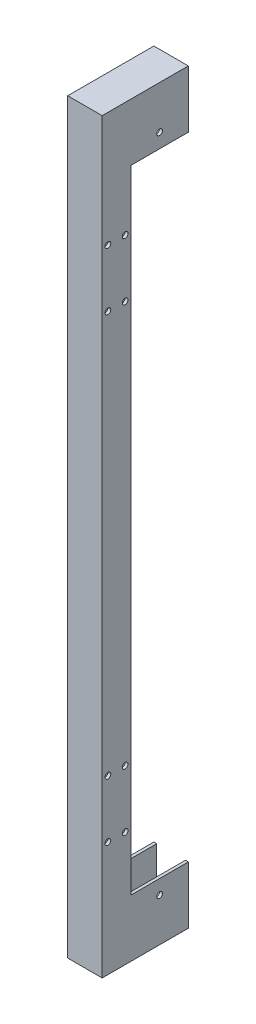
from build123d import *

# Parameters (mm, degrees)
BOSS_EXTRUDE1_DEPTH = 30
SHELL1_START        = -645
SHELL1_OUTLINE_W    = 50
SHELL1_OUTLINE_H    = 40
SHELL1_DEPTH        = 1290
SHELL1_2_OUTLINE_W  = 50
SHELL1_2_OUTLINE_H  = 105
SHELL1_2_DEPTH      = 95
SHELL1_START_2      = 550
SHELL1_3_OUTLINE_W  = 50
SHELL1_3_OUTLINE_H  = 105
SHELL1_3_DEPTH      = 95
SKETCH2_R           = 5
CUT_EXTRUDE1_DEPTH  = 665.623953827
CUT_EXTRUDE2_REACH  = 666.624
SKETCH3_R           = 5


# Read off the part's stored shape, not the designer's step: Shell1
with BuildPart() as part:
    # Sketch1 → Boss-Extrude1 (new, symmetric)
    with BuildSketch(Plane.YZ):
        Polygon((-550, -25), (550, -25), (550, -125), (650, -125), (650, 25), (550, 25), (-550, 25), (-650, 25), (-650, -125), (-550, -125), align=None)
    extrude(amount=BOSS_EXTRUDE1_DEPTH, both=True)

    # Shell1 outline → Shell1 (cut)
    with BuildSketch(Plane(origin=(0, 0, 0), x_dir=(1, 0, 0), z_dir=(0, 1, 0)).offset(SHELL1_START)):
        Rectangle(SHELL1_OUTLINE_W, SHELL1_OUTLINE_H)
    extrude(amount=SHELL1_DEPTH, mode=Mode.SUBTRACT)

    # Shell1 2 outline → Shell1 2 (cut)
    with BuildSketch(Plane(origin=(0, 0, 0), x_dir=(1, 0, 0), z_dir=(0, 1, 0)).offset(SHELL1_START)):
        with Locations((0, 72.5)):
            Rectangle(SHELL1_2_OUTLINE_W, SHELL1_2_OUTLINE_H)
    extrude(amount=SHELL1_2_DEPTH, mode=Mode.SUBTRACT)

    # Shell1 3 outline → Shell1 3 (cut)
    with BuildSketch(Plane(origin=(0, 0, 0), x_dir=(1, 0, 0), z_dir=(0, 1, 0)).offset(SHELL1_START_2)):
        with Locations((0, 72.5)):
            Rectangle(SHELL1_3_OUTLINE_W, SHELL1_3_OUTLINE_H)
    extrude(amount=SHELL1_3_DEPTH, mode=Mode.SUBTRACT)

    # Sketch2 → Cut-Extrude1 (cut, through all)
    with BuildSketch(Plane.YZ.offset(30)):
        with Locations(Location((-575, -75, 0), (0, 0, 270))):
            Circle(SKETCH2_R)
        with Locations(Location((575, -75, 0), (0, 0, 270))):
            Circle(SKETCH2_R)
    extrude(amount=-CUT_EXTRUDE1_DEPTH, mode=Mode.SUBTRACT)

    # Sketch3 → Cut-Extrude2 (cut, up to next)
    with BuildSketch(Plane.YZ.offset(30), mode=Mode.PRIVATE) as cut_extrude2_sk1:
        with Locations(Location((-350, 15, 0), (0, 0, 270))):
            Circle(SKETCH3_R)
    cut_extrude2_tool1 = extrude(cut_extrude2_sk1.sketch, amount=-CUT_EXTRUDE2_REACH, mode=Mode.PRIVATE) & part.part
    # Sketch3 → Cut-Extrude2 (cut, up to next)
    with BuildSketch(Plane.YZ.offset(30), mode=Mode.PRIVATE) as cut_extrude2_sk2:
        with Locations(Location((-350, -15, 0), (0, 0, 270))):
            Circle(SKETCH3_R)
    cut_extrude2_tool2 = extrude(cut_extrude2_sk2.sketch, amount=-CUT_EXTRUDE2_REACH, mode=Mode.PRIVATE) & part.part
    # Sketch3 → Cut-Extrude2 (cut, up to next)
    with BuildSketch(Plane.YZ.offset(30), mode=Mode.PRIVATE) as cut_extrude2_sk3:
        with Locations(Location((-450, 15, 0), (0, 0, 90))):
            Circle(SKETCH3_R)
    cut_extrude2_tool3 = extrude(cut_extrude2_sk3.sketch, amount=-CUT_EXTRUDE2_REACH, mode=Mode.PRIVATE) & part.part
    # Sketch3 → Cut-Extrude2 (cut, up to next)
    with BuildSketch(Plane.YZ.offset(30), mode=Mode.PRIVATE) as cut_extrude2_sk4:
        with Locations(Location((-450, -15, 0), (0, 0, 270))):
            Circle(SKETCH3_R)
    cut_extrude2_tool4 = extrude(cut_extrude2_sk4.sketch, amount=-CUT_EXTRUDE2_REACH, mode=Mode.PRIVATE) & part.part
    # Sketch3 → Cut-Extrude2 (cut, up to next)
    with BuildSketch(Plane.YZ.offset(30), mode=Mode.PRIVATE) as cut_extrude2_sk5:
        with Locations(Location((450, -15, 0), (0, 0, 270))):
            Circle(SKETCH3_R)
    cut_extrude2_tool5 = extrude(cut_extrude2_sk5.sketch, amount=-CUT_EXTRUDE2_REACH, mode=Mode.PRIVATE) & part.part
    # Sketch3 → Cut-Extrude2 (cut, up to next)
    with BuildSketch(Plane.YZ.offset(30), mode=Mode.PRIVATE) as cut_extrude2_sk6:
        with Locations(Location((450, 15, 0), (0, 0, 270))):
            Circle(SKETCH3_R)
    cut_extrude2_tool6 = extrude(cut_extrude2_sk6.sketch, amount=-CUT_EXTRUDE2_REACH, mode=Mode.PRIVATE) & part.part
    # Sketch3 → Cut-Extrude2 (cut, up to next)
    with BuildSketch(Plane.YZ.offset(30), mode=Mode.PRIVATE) as cut_extrude2_sk7:
        with Locations(Location((350, -15, 0), (0, 0, 270))):
            Circle(SKETCH3_R)
    cut_extrude2_tool7 = extrude(cut_extrude2_sk7.sketch, amount=-CUT_EXTRUDE2_REACH, mode=Mode.PRIVATE) & part.part
    # Sketch3 → Cut-Extrude2 (cut, up to next)
    with BuildSketch(Plane.YZ.offset(30), mode=Mode.PRIVATE) as cut_extrude2_sk8:
        with Locations(Location((350, 15, 0), (0, 0, 90))):
            Circle(SKETCH3_R)
    cut_extrude2_tool8 = extrude(cut_extrude2_sk8.sketch, amount=-CUT_EXTRUDE2_REACH, mode=Mode.PRIVATE) & part.part
    add(cut_extrude2_tool1.solids().sort_by_distance((30, -350, 15))[0], mode=Mode.SUBTRACT)
    add(cut_extrude2_tool2.solids().sort_by_distance((30, -350, -15))[0], mode=Mode.SUBTRACT)
    add(cut_extrude2_tool3.solids().sort_by_distance((30, -450, 15))[0], mode=Mode.SUBTRACT)
    add(cut_extrude2_tool4.solids().sort_by_distance((30, -450, -15))[0], mode=Mode.SUBTRACT)
    add(cut_extrude2_tool5.solids().sort_by_distance((30, 450, -15))[0], mode=Mode.SUBTRACT)
    add(cut_extrude2_tool6.solids().sort_by_distance((30, 450, 15))[0], mode=Mode.SUBTRACT)
    add(cut_extrude2_tool7.solids().sort_by_distance((30, 350, -15))[0], mode=Mode.SUBTRACT)
    add(cut_extrude2_tool8.solids().sort_by_distance((30, 350, 15))[0], mode=Mode.SUBTRACT)


solid = part.part
